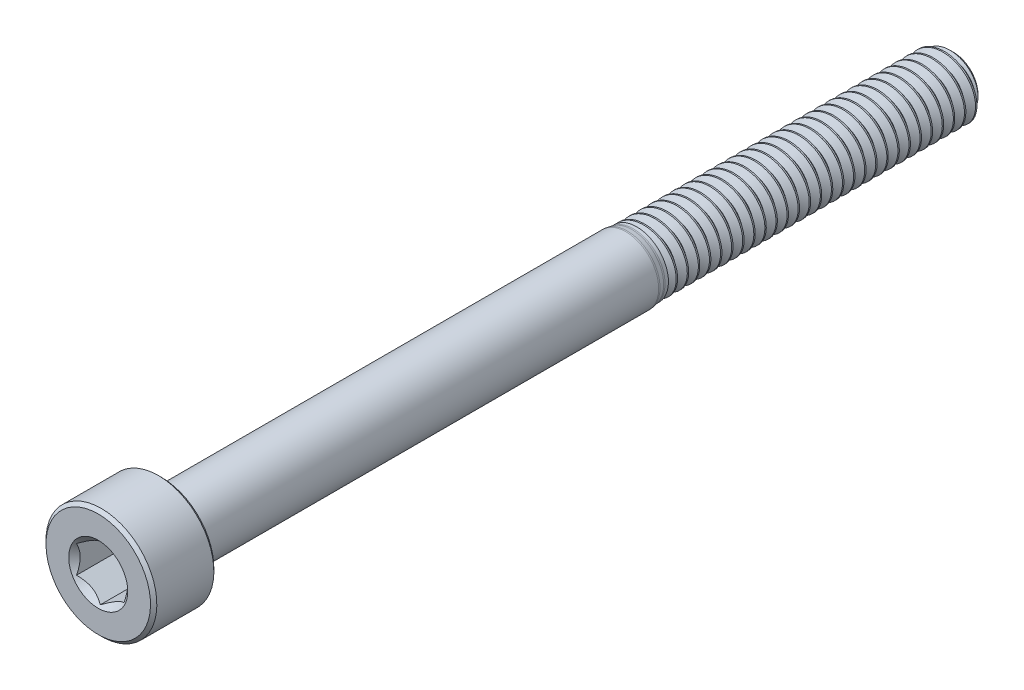
from build123d import *

# Parameters (mm, degrees)
CUT_EXTRUDE1_DEPTH     = 3
SPLIT1_SURFACE_1_BACK  = 55.9
SPLIT1_SURFACE_1_DEPTH = 111.8
SPLIT1_SURFACE_2_BACK  = 55.9
SPLIT1_SURFACE_2_DEPTH = 111.8
CUT_SWEEP1_PITCH       = 0.7
CUT_SWEEP1_TO          = 20


with BuildPart() as part:
    # Sketch2 → Revolve1 (revolve)
    with BuildSketch(Plane(origin=(0, 0, 0), x_dir=(0, 0, -1), z_dir=(1, 0, 0))):
        with BuildLine():
            Line((-27, 0), (-27, 3.3))
            Line((-27, 3.3), (-26.8, 3.5))
            Line((-26.8, 3.5), (-23.2, 3.5))
            Line((-23.2, 3.5), (-23, 3.3))
            Line((-23, 3.3), (-23, 2.275777223))
            ThreePointArc((-23, 2.275777223), (-22.941421356, 2.134355867), (-22.8, 2.075777223))
            Line((-22.8, 2.075777223), (6.307296473, 2.075777223))
            ThreePointArc((6.307296473, 2.075777223), (6.356305044, 2.073369586), (6.404841634, 2.066169863))
            Line((6.404841634, 2.066169863), (6.689200541, 2.00960736))
            ThreePointArc((6.689200541, 2.00960736), (6.737737132, 2.002407637), (6.786745702, 2))
            Line((6.786745702, 2), (26.545336663, 2))
            Line((26.545336663, 2), (27, 1.545336663))
            Line((27, 1.545336663), (27, 0))
            Line((27, 0), (-27, 0))
        make_face()
    revolve(axis=Axis((0, 0, -27), (0, 0, 1)))

    # Sketch3 → Cut-Extrude1 (cut)
    with BuildSketch(Plane.XY.offset(27)):
        Polygon((1.5, -0.866025404), (1.5, 0.866025404), (0, 1.732050808), (-1.5, 0.866025404), (-1.5, -0.866025404), (0, -1.732050808), align=None)
    extrude(amount=-CUT_EXTRUDE1_DEPTH, mode=Mode.SUBTRACT)

    # Cut-Extrude2 cone 1 section (through the dimple's axis) → Cut-Extrude2 (revolve, cut)
    with BuildSketch(Plane(origin=(0, 0, 27), x_dir=(0, -1, 0), z_dir=(1, 0, 0))):
        Polygon((0, 0), (1.861954618, 0), (0, 1.861954618), align=None)
    revolve(axis=Axis((0, 0, 27), (0, 0, -1)), mode=Mode.SUBTRACT)


with BuildPart() as body_2:
    # Split1: the piece behind the surface
    add(part.part)
    # Split1 surface: a surface, the sketch's curves swept straight by 111.8 mm
    with BuildLine(Plane(origin=(0, 0, 0), x_dir=(0, 0, -1), z_dir=(1, 0, 0)).offset(-SPLIT1_SURFACE_1_BACK), mode=Mode.PRIVATE) as split1_surface_1_path:
        Line((7, -2), (7, 2))
    split1_surface_1 = Shell.extrude(split1_surface_1_path.wire(), (1 * SPLIT1_SURFACE_1_DEPTH, 0 * SPLIT1_SURFACE_1_DEPTH, 0 * SPLIT1_SURFACE_1_DEPTH))
    split(bisect_by=split1_surface_1, keep=Keep.BOTTOM)

    # Cut-Sweep1: arcs per turn and ends read off the stored shape
    # Cut-Sweep1: the profile of Sketch7 screwed along a right-hand helix through 29.571429 turns, 6 arcs to a turn; built about Z, then put on its axis
    cut_sweep1_z = Axis((0, 0, 0), (0, 0, 1))
    cut_sweep1_corners = [(2.037888611, 0, 0.021875), (2.037888611, 0, -0.634375), (1.545336663, 0, -0.35), (1.545336663, 0, -0.2625)]
    with BuildLine(mode=Mode.PRIVATE) as cut_sweep1_profile:
        Line(cut_sweep1_corners[0], cut_sweep1_corners[1])
        Line(cut_sweep1_corners[1], cut_sweep1_corners[2])
        Line(cut_sweep1_corners[2], cut_sweep1_corners[3])
        Line(cut_sweep1_corners[3], cut_sweep1_corners[0])
    cut_sweep1_cap = Face(cut_sweep1_profile.wire())
    cut_sweep1_turn_angles = [0, 30, 60, 90, 120, 150, 180, 210, 240, 270, 300, 330, 360]
    cut_sweep1_turn_weights = [1, 0.8660254037844387, 1, 0.8660254037844387, 1, 0.8660254037844387, 1, 0.8660254037844387, 1, 0.8660254037844387, 1, 0.8660254037844387, 1]
    cut_sweep1_turn_rails = [Edge.make_bspline([Vector(p[0], p[1], 0).rotate(cut_sweep1_z, cut_sweep1_turn_angles[k]) / cut_sweep1_turn_weights[k] + Vector(0, 0, p[2] + CUT_SWEEP1_PITCH * cut_sweep1_turn_angles[k] / 360) for k in range(13)], [0, 0, 0, 1, 1, 2, 2, 3, 3, 4, 4, 5, 5, 6, 6, 6], 2, cut_sweep1_turn_weights) for p in cut_sweep1_corners]
    cut_sweep1_turn_sides = [Face.make_surface_from_curves(cut_sweep1_turn_rails[p[0]], cut_sweep1_turn_rails[p[1]]) for p in [(0, 1), (1, 2), (2, 3), (3, 0)]]
    cut_sweep1_last_angles = [10440, 10470, 10500, 10530, 10560, 10590, 10620, 10632.857142857, 10645.714285714]
    cut_sweep1_last_weights = [1, 0.8660254037844387, 1, 0.8660254037844387, 1, 0.8660254037844387, 1, 0.9749279121817342, 1]
    cut_sweep1_last_rails = [Edge.make_bspline([Vector(p[0], p[1], 0).rotate(cut_sweep1_z, cut_sweep1_last_angles[k]) / cut_sweep1_last_weights[k] + Vector(0, 0, p[2] + CUT_SWEEP1_PITCH * cut_sweep1_last_angles[k] / 360) for k in range(9)], [0, 0, 0, 1, 1, 2, 2, 3, 3, 4, 4, 4], 2, cut_sweep1_last_weights) for p in cut_sweep1_corners]
    cut_sweep1_last_sides = [Face.make_surface_from_curves(cut_sweep1_last_rails[p[0]], cut_sweep1_last_rails[p[1]]) for p in [(0, 1), (1, 2), (2, 3), (3, 0)]]
    cut_sweep1 = Plane(origin=(0, 0, -27), x_dir=(0, 1, 0), z_dir=(0, 0, 1)) * split(Solid(Shell([*[p.moved(Location((0, 0, CUT_SWEEP1_PITCH * i))) for i in range(29) for p in cut_sweep1_turn_sides], *cut_sweep1_last_sides, cut_sweep1_cap, cut_sweep1_cap.rotate(cut_sweep1_z, 10645.714285714).moved(Location((0, 0, CUT_SWEEP1_PITCH * 10645.714285714 / 360)))])), bisect_by=Plane.XY.offset(CUT_SWEEP1_TO), keep=Keep.BOTTOM, mode=Mode.PRIVATE)
    add(cut_sweep1, mode=Mode.SUBTRACT)


with BuildPart() as part_1:
    add(part.part)

    # Split1: split by a surface, the side it looks to stays
    # Split1 surface: a surface, the sketch's curves swept straight by 111.8 mm
    with BuildLine(Plane(origin=(0, 0, 0), x_dir=(0, 0, -1), z_dir=(1, 0, 0)).offset(-SPLIT1_SURFACE_2_BACK), mode=Mode.PRIVATE) as split1_surface_2_path:
        Line((7, -2), (7, 2))
    split1_surface_2 = Shell.extrude(split1_surface_2_path.wire(), (1 * SPLIT1_SURFACE_2_DEPTH, 0 * SPLIT1_SURFACE_2_DEPTH, 0 * SPLIT1_SURFACE_2_DEPTH))
    split(bisect_by=split1_surface_2, keep=Keep.TOP)

    add(body_2.part)  # Revolve2 merges body 2
    # Sketch8 → Revolve2 (revolve)
    with BuildSketch(Plane(origin=(0, 0, 0), x_dir=(0, 0, -1), z_dir=(1, 0, 0))):
        Polygon((-23, 0), (-23, 2), (7, 2), (8.154700538, 0), align=None)
    revolve(axis=Axis((0, 0, -8.154700538), (0, 0, 1)))


solid = part_1.part
